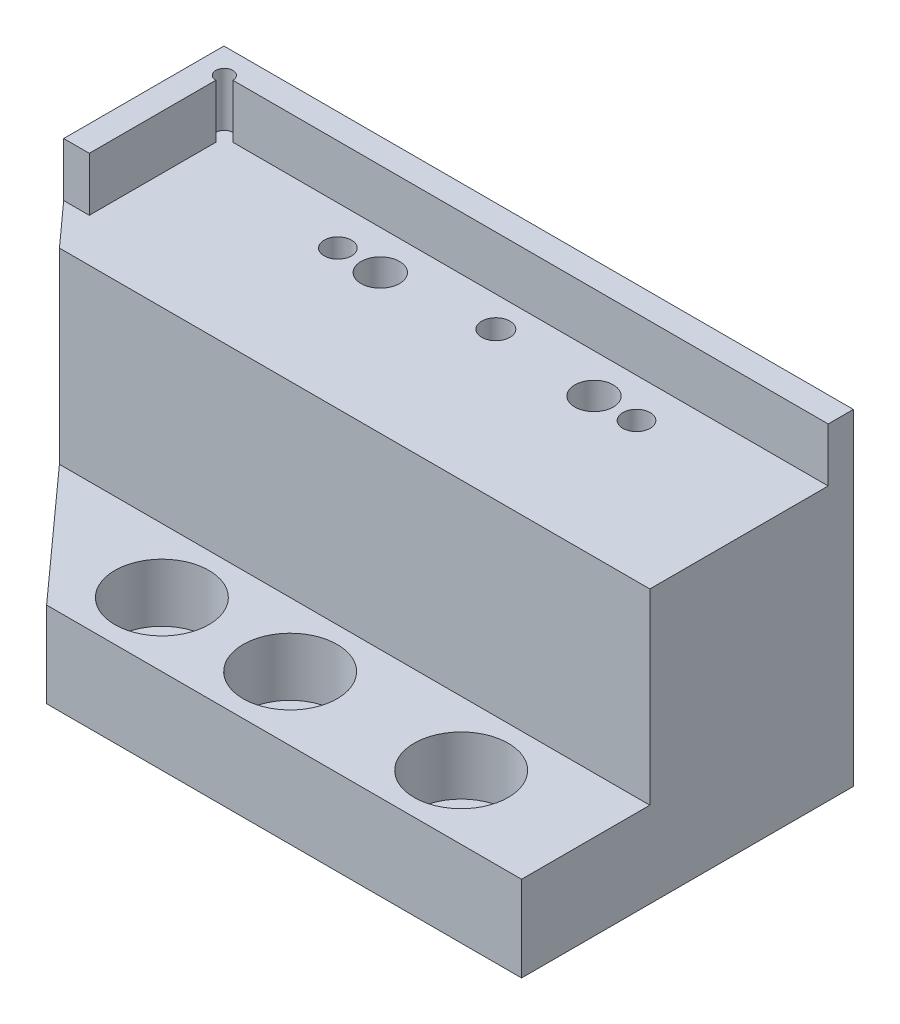
from build123d import *
from build123d.topology import SkipClean

# Parameters (mm, degrees)
SKETCH_1_W                = 76.6
SKETCH_1_H                = 23.8
EXTRUDE_1_DEPTH           = 31.899999991
HOLE_WIZARD_M4_1_D        = 3.3
HOLE_WIZARD_M4_1_DEPTH    = 10.1
HOLE_WIZARD_M4_1_TIP      = 0.991420021
SKETCH_5_W                = 23.8
SKETCH_5_H                = 2.281370048
EXTRUDE_2_DEPTH           = 2.994
SKETCH_6_W                = 76.6
SKETCH_6_H                = 2.281370048
EXTRUDE_3_DEPTH           = 2.944
CUT_EXTRUDE_START         = -2.994
SKETCH_7_W                = 26.992148155
SKETCH_7_H                = 47.339562986
CUT_EXTRUDE_1_DEPTH       = 2.994
EXTRUDE_4_DEPTH           = 10
HOLE_WIZARD_3_D           = 6.6
HOLE_WIZARD_3_CBORE_D     = 11
HOLE_WIZARD_3_CBORE_DEPTH = 6.8
SKETCH_21_R               = 3.3
CUT_EXTRUDE_6_DEPTH       = 67.034934903
MM_2_D                    = 4
MM_2_DEPTH                = 5
MM_2_TIP                  = 1.201721238
CUT_EXTRUDE_7_DEPTH       = 5
SKETCH_26_W               = 46.053862543
SKETCH_26_H               = 10
CUT_EXTRUDE_8_DEPTH       = 76.924939501
CUT_EXTRUDE_9_DEPTH       = 67.034934903
SKETCH_29_R               = 1
CUT_EXTRUDE_10_DEPTH      = 2.281370048
EXTRUDE_START             = 4
EXTRUDE_5_DEPTH           = 4
CUT_EXTRUDE_11_DEPTH      = 0.5
EXTRUDE_6_DEPTH           = 0.440630619
CUT_EXTRUDE_12_DEPTH      = 28.181370038
SKETCH_35_W               = 0.294839433
SKETCH_35_H               = 10
CUT_EXTRUDE_13_DEPTH      = 100.471808588
CHAMFER_1_SIZE            = 2
HOLE_WIZARD_4_D           = 4.5
HOLE_WIZARD_4_CBORE_D     = 8
HOLE_WIZARD_4_CBORE_DEPTH = 25
CUT_EXTRUDE_14_DEPTH      = 67.233425798
CUT_EXTRUDE_15_DEPTH      = 6.281370048


with BuildPart() as part:
    # 草图1 → 凸台-拉伸1 (new body)
    with BuildSketch(Plane(origin=(0, 0, 0), x_dir=(1, 0, 0), z_dir=(0, 1, 0))):
        Rectangle(SKETCH_1_W, SKETCH_1_H)
    extrude(amount=-EXTRUDE_1_DEPTH)

    # M4 螺纹孔1
    with Locations(Plane(origin=(0, 0, -5.4), x_dir=(0, 0, 1), z_dir=(0, 1, 0))):
        with Locations((0, 0)):
            Hole(HOLE_WIZARD_M4_1_D / 2, depth=HOLE_WIZARD_M4_1_DEPTH)
            with Locations((0, 0, -(HOLE_WIZARD_M4_1_DEPTH + HOLE_WIZARD_M4_1_TIP / 2))):  # 118° drill point
                Cone(0, HOLE_WIZARD_M4_1_D / 2, HOLE_WIZARD_M4_1_TIP, mode=Mode.SUBTRACT)

    # 草图5 → 凸台-拉伸2 (add)
    with BuildSketch(Plane.ZY.offset(38.3)):
        with Locations((0, 1.140685024)):
            Rectangle(SKETCH_5_W, SKETCH_5_H)
    extrude(amount=-EXTRUDE_2_DEPTH)

    # 草图6 → 凸台-拉伸3 (add)
    with BuildSketch(Plane(origin=(0, 0, -11.9), x_dir=(-1, 0, 0), z_dir=(0, 0, -1))):
        with Locations((0, 1.140685024)):
            Rectangle(SKETCH_6_W, SKETCH_6_H)
    extrude(amount=-EXTRUDE_3_DEPTH)

    # 草图7 → 切除-拉伸1 (cut)
    with BuildSketch(Plane(origin=(38.3, 0, 0), x_dir=(0, 0, -1), z_dir=(1, 0, 0)).offset(CUT_EXTRUDE_START)):
        with Locations((-1.596074077, -8.230218498)):
            Rectangle(SKETCH_7_W, SKETCH_7_H)
    extrude(amount=CUT_EXTRUDE_1_DEPTH, mode=Mode.SUBTRACT)

    # 草图9 → 大小mm 暗销孔1 (revolve, cut)
    with BuildSketch(Plane(origin=(17.4625, 0, -4.384), x_dir=(0, 0, 1), z_dir=(1, 0, 0))):
        Polygon((0, 0), (0, 5.96137699), (1.6, 5), (1.6, 0), align=None)
    mm_1 = revolve(axis=Axis((17.4625, 6.35, -4.384), (0, -1, 0)), mode=Mode.SUBTRACT)

    # 镜向3: 大小mm 暗销孔1 across plane
    add(mm_1.mirror(Plane(origin=(0, 0, 0), x_dir=(0, 0, 1), z_dir=(1, 0, 0))), mode=Mode.SUBTRACT)

    # 草图16 → 凸台-拉伸4 (add)
    with BuildSketch(Plane.XZ.offset(31.899999991)):
        Polygon((-38.3, 6.921881597), (-55.247298311, -11.9), (-38.3, -11.9), align=None)
        Polygon((-33.817682057, 11.9), (-20.311621392, 26.9), (35.306, 26.9), (35.306, 11.9), align=None)
    extrude(amount=-EXTRUDE_4_DEPTH)

    # 打孔尺寸(%根据)内六角圆柱头螺钉的类型3 (through all)
    with Locations(Plane(origin=(-14.255841028, -21.899999991, 19.4), x_dir=(1, 0, 0), z_dir=(0, 1, 0))):
        with Locations((0, 0), (15, 0), (35, 0)):
            CounterBoreHole(HOLE_WIZARD_3_D / 2, HOLE_WIZARD_3_CBORE_D / 2, HOLE_WIZARD_3_CBORE_DEPTH)

    # 草图21 → 切除-拉伸6 (cut, through all)
    with BuildSketch(Plane(origin=(0, -21.899999991, 0), x_dir=(1, 0, 0), z_dir=(0, 1, 0))):
        with Locations(Location((-44.3, 5.9, 0), (0, 0, 180))):
            Circle(SKETCH_21_R)
    extrude(amount=-CUT_EXTRUDE_6_DEPTH, mode=Mode.SUBTRACT)

    # 大小mm 暗销孔2
    with Locations(Plane(origin=(10.744158972, -31.899999991, 9.4), x_dir=(0, 0, -1), z_dir=(0, -1, 0))):
        with Locations((0, 0)):
            Hole(MM_2_D / 2, depth=MM_2_DEPTH)
            with Locations((0, 0, -(MM_2_DEPTH + MM_2_TIP / 2))):  # 118° drill point
                Cone(0, MM_2_D / 2, MM_2_TIP, mode=Mode.SUBTRACT)

    # 草图25 → 切除-拉伸7 (cut)
    with BuildSketch(Plane.XZ.offset(31.899999991)):
        with BuildLine():
            Line((-9.755841028, 11.4), (-8.755841028, 11.4))
            ThreePointArc((-8.755841028, 11.4), (-6.755841028, 9.4), (-8.755841028, 7.4))
            Line((-8.755841028, 7.4), (-9.755841028, 7.4))
            ThreePointArc((-9.755841028, 7.4), (-11.755841028, 9.4), (-9.755841028, 11.4))
        make_face()
    extrude(amount=-CUT_EXTRUDE_7_DEPTH, mode=Mode.SUBTRACT)

    # 草图26 → 切除-拉伸8 (cut, through all)
    with BuildSketch(Plane(origin=(-24.593701474, 0, 22.144268272), x_dir=(0.6691306063588817, 0, 0.7431448254773731), z_dir=(-0.7431448254773731, 0, 0.6691306063588817))):
        with Locations((-11.827706241, -26.899999991)):
            Rectangle(SKETCH_26_W, SKETCH_26_H)
    extrude(amount=CUT_EXTRUDE_8_DEPTH, mode=Mode.SUBTRACT)

    # 草图27 → 切除-拉伸9 (cut, through all)
    with BuildSketch(Plane.XZ.offset(21.899999991)):
        Polygon((-38.3, 6.921881597), (-33.817682057, 11.9), (-38.3, 11.9), align=None)
    extrude(amount=-CUT_EXTRUDE_9_DEPTH, mode=Mode.SUBTRACT)

    # 草图29 → 切除-拉伸10 (cut)
    with BuildSketch(Plane(origin=(0, 2.281370048, 0), x_dir=(1, 0, 0), z_dir=(0, 1, 0))):
        with Locations((-35.306, 8.956)):
            Circle(SKETCH_29_R)
    extrude(amount=-CUT_EXTRUDE_10_DEPTH, mode=Mode.SUBTRACT)

    # 草图31 → 凸台-拉伸5 (add)
    with SkipClean():  # the faces are left unmerged after this step: merging them gives an invalid solid
        with BuildSketch(Plane(origin=(0, 2.281370048, 0), x_dir=(1, 0, 0), z_dir=(0, 1, 0)).offset(EXTRUDE_START)):
            with BuildLine():
                Line((-34.306, 8.956), (35.306, 8.956))
                Line((35.306, 8.956), (35.306, 11.9))
                Line((35.306, 11.9), (-38.3, 11.9))
                Line((-38.3, 11.9), (-38.3, -6.921881597))
                Line((-38.3, -6.921881597), (-35.306, -10.247055466))
                Line((-35.306, -10.247055466), (-35.306, 7.956))
                ThreePointArc((-35.306, 7.956), (-36.013106781, 9.663106781), (-34.306, 8.956))
            make_face()
        extrude(amount=-EXTRUDE_5_DEPTH)

    # 草图32 → 切除-拉伸11 (cut)
    with SkipClean():  # the faces are left unmerged after this step: merging them gives an invalid solid
        with BuildSketch(Plane(origin=(-24.593701474, 0, 22.144268272), x_dir=(0.6691306063588817, 0, 0.7431448254773731), z_dir=(-0.7431448254773731, 0, 0.6691306063588817))):
            Polygon((-23.813531784, -21.899999991), (-45.811081642, -21.899999991), (-45.811081642, -31.899999991), (7.49870663, -31.899999991), (7.49870663, -21.899999991), (-11.951824765, -21.899999991), (-11.951824765, 0), (-16.009278942, 0), (-16.009278942, 6.281370048), (-23.813531784, 6.281370048), align=None)
        extrude(amount=-CUT_EXTRUDE_11_DEPTH, mode=Mode.SUBTRACT)

    # 草图33 → 凸台-拉伸6 (add)
    with SkipClean():  # the faces are left unmerged after this step: merging them gives an invalid solid
        with BuildSketch(Plane(origin=(-24.222129061, 0, 21.809702968), x_dir=(0.6691306063588818, 0, 0.743144825477373), z_dir=(-0.743144825477373, 0, 0.6691306063588818))):
            Polygon((-45.36087962, -21.899999991), (-45.36087962, -31.899999991), (6.849670289, -31.899999991), (6.849670289, -21.899999991), (-13.334820655, -21.899999991), (-13.334820655, 0), (-16.564585199, 0), (-16.564585199, 6.281370048), (-21.03904799, 6.281370048), (-21.03904799, -21.899999991), align=None)
        extrude(amount=EXTRUDE_6_DEPTH)

    # 草图34 → 切除-拉伸12 (cut)
    with SkipClean():  # the faces are left unmerged after this step: merging them gives an invalid solid
        with BuildSketch(Plane(origin=(0, 6.281370048, 0), x_dir=(1, 0, 0), z_dir=(0, 1, 0))):
            Polygon((-38.3, -6.174643322), (-38.3, -6.833155448), (-38.627452364, -6.469482755), align=None)
            Polygon((-33.144865692, -11.9), (-33.737792674, -11.9), (-33.472318056, -12.194839433), align=None)
        extrude(amount=-CUT_EXTRUDE_12_DEPTH, mode=Mode.SUBTRACT)

    # 草图35 → 切除-拉伸13 (cut, through all)
    with SkipClean():  # the faces are left unmerged after this step: merging them gives an invalid solid
        with BuildSketch(Plane(origin=(35.306, 0, 0), x_dir=(0, 0, -1), z_dir=(1, 0, 0))):
            with Locations((-27.047419717, -26.899999991)):
                Rectangle(SKETCH_35_W, SKETCH_35_H)
        extrude(amount=-CUT_EXTRUDE_13_DEPTH, mode=Mode.SUBTRACT)

    # 倒角1
    # the kernel refuses this chamfer: 2 mm, written as the material it takes off along each edge
    with BuildSketch(Plane(origin=(-54.901934311, -16.756634015, -11.605160567), x_dir=(0.7244655223975905, 0, -0.6893110378176068), z_dir=(0, -1, 0))) as chamfer_1_piece_1:
        Polygon((CHAMFER_1_SIZE * 0.999621916911, CHAMFER_1_SIZE * 0.0274958766106), (-CHAMFER_1_SIZE * 0.0274958766106, CHAMFER_1_SIZE * 0.999621916911), (0, 0), align=None)
    extrude(amount=20.286731952, mode=Mode.SUBTRACT)
    with BuildSketch(Plane(origin=(-35.633452364, 0, 9.794656625), x_dir=(-0.6893110378176083, 0, -0.7244655223975892), z_dir=(0, 1, 0))) as chamfer_1_piece_2:
        Polygon((CHAMFER_1_SIZE * 0.999621916911, -CHAMFER_1_SIZE * 0.0274958766106), (-CHAMFER_1_SIZE * 0.0274958766106, -CHAMFER_1_SIZE * 0.999621916911), (0, 0), align=None)
    extrude(amount=11.424736024, mode=Mode.SUBTRACT)

    # 打孔尺寸(%根据)内六角圆柱头螺钉的类型4 (through all)
    with Locations(Plane(origin=(12.5, -31.899999991, -4.384), x_dir=(0, 0, -1), z_dir=(0, -1, 0))):
        with Locations((0, 0)):
            hole_wizard_4 = CounterBoreHole(HOLE_WIZARD_4_D / 2, HOLE_WIZARD_4_CBORE_D / 2, HOLE_WIZARD_4_CBORE_DEPTH)

    # 镜向4: 打孔尺寸(%根据)内六角圆柱头螺钉的类型4 across plane
    add(hole_wizard_4.mirror(Plane(origin=(0, 0, 0), x_dir=(0, 0, 1), z_dir=(1, 0, 0))), mode=Mode.SUBTRACT)

    # 草图39 → 切除-拉伸14 (cut, through all)
    with BuildSketch(Plane(origin=(0, -21.899999991, 0), x_dir=(1, 0, 0), z_dir=(0, 1, 0))):
        Polygon((-53.470328078, 11.9), (-53.470328078, 10.015200769), (-53.563673098, 10.118870916), align=None)
    extrude(amount=-CUT_EXTRUDE_14_DEPTH, mode=Mode.SUBTRACT)

    # 草图40 → 切除-拉伸15 (cut)
    with BuildSketch(Plane(origin=(0, 6.281370048, 0), x_dir=(1, 0, 0), z_dir=(0, 1, 0))):
        Polygon((-38.3, -6.837514338), (-35.306, -6.837514338), (-35.306, -8.395663323), (-36.971713577, -8.308366973), align=None)
    extrude(amount=-CUT_EXTRUDE_15_DEPTH, mode=Mode.SUBTRACT)


solid = part.part
